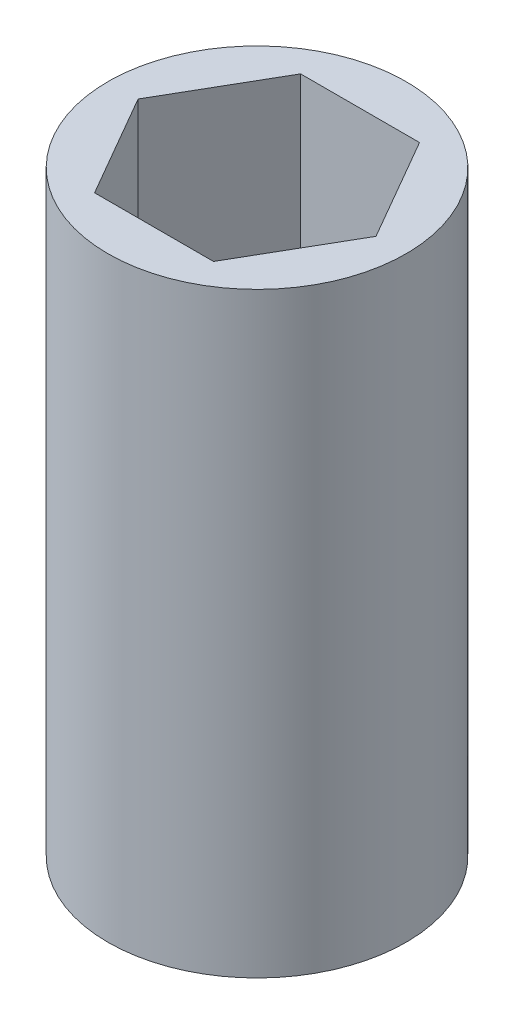
from build123d import *

# Parameters (mm, degrees)
SKETCH1_R           = 6.985
BOSS_EXTRUDE1_DEPTH = 27.94


with BuildPart() as part:
    # Sketch1 → Boss-Extrude1 (new body)
    with BuildSketch(Plane(origin=(0, 0, 0), x_dir=(1, 0, 0), z_dir=(0, 1, 0))):
        Circle(SKETCH1_R)
        Polygon((2.786292399, -4.826), (5.572584798, 0), (2.786292399, 4.826), (-2.786292399, 4.826), (-5.572584798, 0), (-2.786292399, -4.826), align=None, mode=Mode.SUBTRACT)
    extrude(amount=BOSS_EXTRUDE1_DEPTH)


solid = part.part
